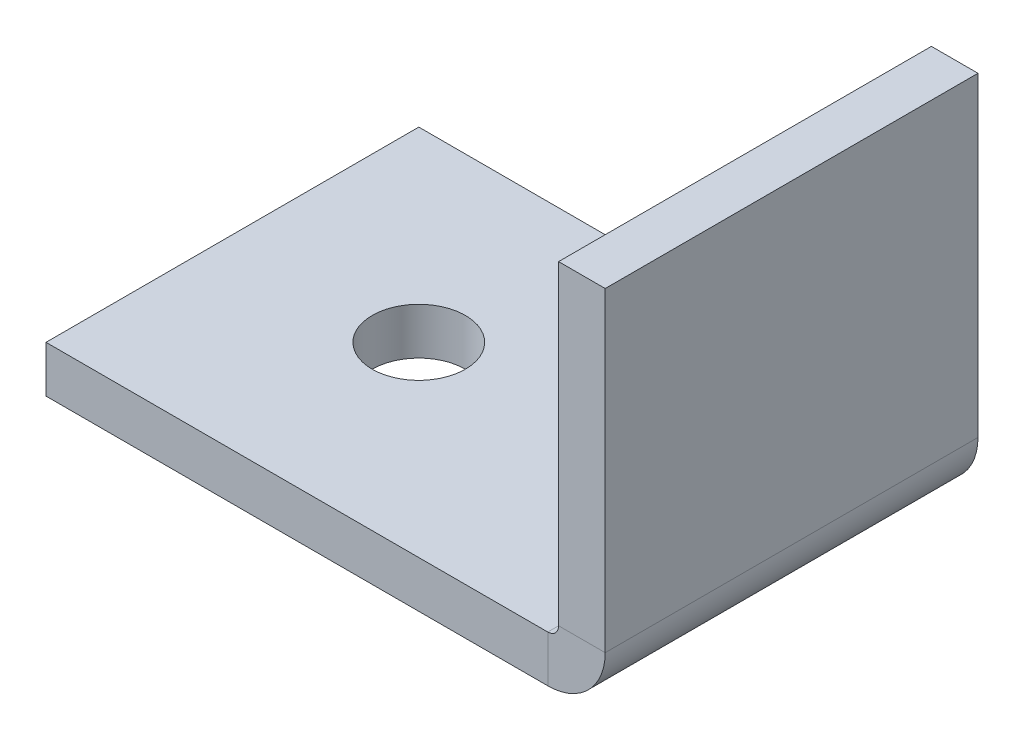
from build123d import *

# Parameters (mm, degrees)
SKETCH1_W                    = 38.1
SKETCH1_H                    = 25.4
BASE_FLANGE1_DEPTH           = 3.175
EDGE_FLANGE1_STRIP_W         = 14.1732
EDGE_FLANGE1_STRIP_H         = 3.175
EDGE_FLANGE1_STRIP_CUT_DEPTH = 25.4
EDGE_FLANGE1_DEPTH           = 25.4
SKETCH10_R                   = 3.175
CUT_EXTRUDE1_DEPTH           = 32.908355097


# Sheet-metal steps are written as plain solids
with BuildPart() as part:
    # Sketch1 → Base-Flange1 (new body)
    with BuildSketch(Plane(origin=(0, 0, 0), x_dir=(1, 0, 0), z_dir=(0, 1, 0))):
        Rectangle(SKETCH1_W, SKETCH1_H)
    extrude(amount=-BASE_FLANGE1_DEPTH)

    # Edge-Flange1 strip (across the edge) → Edge-Flange1 strip cut (cut)
    with BuildSketch(Plane(origin=(19.05, 0, 12.7), x_dir=(-1, 0, 0), z_dir=(0, 0, -1))):
        with Locations((-3.175, -1.5875)):
            Rectangle(EDGE_FLANGE1_STRIP_W, EDGE_FLANGE1_STRIP_H)
    extrude(amount=EDGE_FLANGE1_STRIP_CUT_DEPTH, mode=Mode.SUBTRACT)

    # Edge-Flange1 section (across the edge) → Edge-Flange1 (add)
    with BuildSketch(Plane(origin=(19.05, 0, 12.7), x_dir=(-1, 0, 0), z_dir=(0, 0, -1))):
        with BuildLine():
            Line((0, 0.7366), (0, 22.225))
            Line((0, 22.225), (3.175, 22.225))
            Line((3.175, 22.225), (3.175, 0.7366))
            ThreePointArc((3.175, 0.7366), (3.390745145, 0.215745145), (3.9116, 0))
            Line((3.9116, 0), (3.9116, -3.175))
            ThreePointArc((3.9116, -3.175), (1.145681115, -2.029318885), (0, 0.7366))
        make_face()
    extrude(amount=EDGE_FLANGE1_DEPTH)

    # Sketch10 → Cut-Extrude1 (cut, through all)
    with BuildSketch(Plane(origin=(0, 0, 0), x_dir=(1, 0, 0), z_dir=(0, 1, 0))):
        with Locations(Location((-6.35, 0, 0), (0, 0, 270))):
            Circle(SKETCH10_R)
    extrude(amount=-CUT_EXTRUDE1_DEPTH, mode=Mode.SUBTRACT)


solid = part.part
